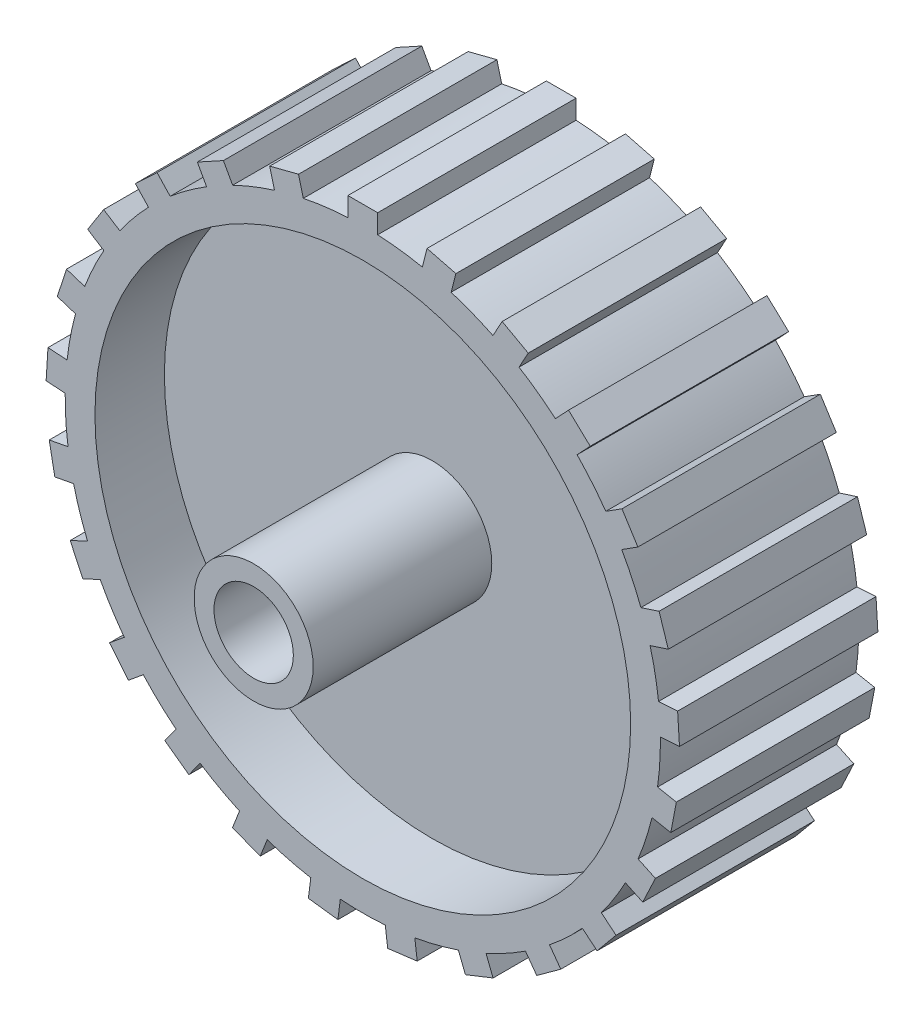
from build123d import *
from build123d.topology import SkipClean

# Parameters (mm, degrees)
SKETCH1_R           = 30
BOSS_EXTRUDE1_DEPTH = 20
SKETCH2_R           = 27
CUT_EXTRUDE1_DEPTH  = 7
CUT_EXTRUDE2_START  = -9
SKETCH3_R           = 27
CUT_EXTRUDE2_DEPTH  = 9
SKETCH4_R           = 6
SKETCH4_R_2         = 4
BOSS_EXTRUDE2_DEPTH = 18
BOSS_EXTRUDE3_START = 2
SKETCH5_R           = 6
BOSS_EXTRUDE3_DEPTH = 2
CUT_EXTRUDE7_START  = -42
SKETCH6_R           = 4
CUT_EXTRUDE7_DEPTH  = 42
SKETCH7_W           = 3
SKETCH7_H           = 2
BOSS_EXTRUDE4_DEPTH = 20
CIRPATTERN1_COUNT   = 25


with BuildPart() as part:
    # Sketch1 → Boss-Extrude1 (new body)
    with BuildSketch(Plane.XY):
        Circle(SKETCH1_R)
    extrude(amount=BOSS_EXTRUDE1_DEPTH)

    # Sketch2 → Cut-Extrude1 (cut)
    with BuildSketch(Plane.XY.offset(20)):
        Circle(SKETCH2_R)
    extrude(amount=-CUT_EXTRUDE1_DEPTH, mode=Mode.SUBTRACT)

    # Sketch3 → Cut-Extrude2 (cut)
    with BuildSketch(Plane(origin=(0, 0, 0), x_dir=(-1, 0, 0), z_dir=(0, 0, -1)).offset(CUT_EXTRUDE2_START)):
        with Locations(Location((0, 0, 0), (0, 0, 180))):
            Circle(SKETCH3_R)
    extrude(amount=CUT_EXTRUDE2_DEPTH, mode=Mode.SUBTRACT)

    # Sketch4 → Boss-Extrude2 (add)
    with BuildSketch(Plane.XY.offset(13)):
        Circle(SKETCH4_R)
        Circle(SKETCH4_R_2, mode=Mode.SUBTRACT)
    extrude(amount=BOSS_EXTRUDE2_DEPTH)

    # Sketch5 → Boss-Extrude3 (add)
    with BuildSketch(Plane(origin=(0, 0, 9), x_dir=(-1, 0, 0), z_dir=(0, 0, -1)).offset(BOSS_EXTRUDE3_START)):
        with Locations(Location((0, 0, 0), (0, 0, 180))):
            Circle(SKETCH5_R)
    extrude(amount=-BOSS_EXTRUDE3_DEPTH)

    # Sketch6 → Cut-Extrude7 (cut)
    with SkipClean():  # the faces are left unmerged after this step: merging them gives an invalid solid
        with BuildSketch(Plane.XY.offset(31).offset(CUT_EXTRUDE7_START)):
            with Locations(Location((0, 0, 0), (0, 0, 180))):
                Circle(SKETCH6_R)
        extrude(amount=CUT_EXTRUDE7_DEPTH, mode=Mode.SUBTRACT)
    add(part.part.scale(1), mode=Mode.REPLACE)  # the faces are merged on a copy

    # Sketch7 → Boss-Extrude4 (add)
    with BuildSketch(Plane.XY.offset(20)):
        with Locations((0, 30.891402014)):
            Rectangle(SKETCH7_W, SKETCH7_H)
    boss_extrude4 = extrude(amount=-BOSS_EXTRUDE4_DEPTH)

    # CirPattern1: Boss-Extrude4 ×25 about axis
    cirpattern1_axis = Axis((0, 0, 0), (0, 0, 1))
    for i in range(1, CIRPATTERN1_COUNT):
        add(boss_extrude4.rotate(cirpattern1_axis, i * 360 / CIRPATTERN1_COUNT))


solid = part.part
